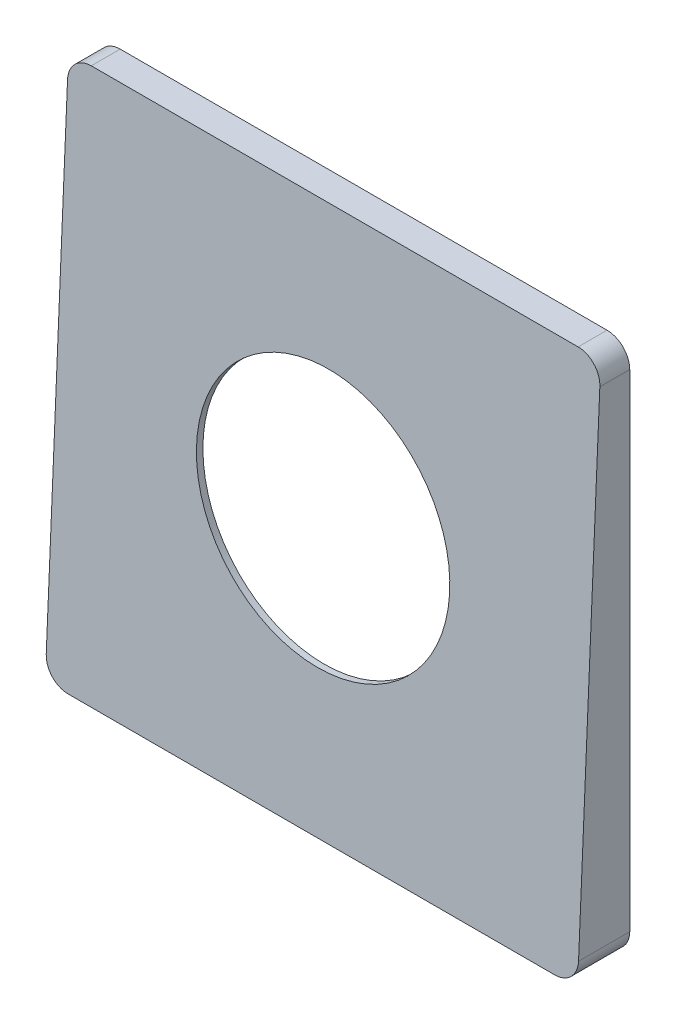
from build123d import *

# Parameters (mm, degrees)
EXTRUDE_THIN1_DEPTH     = 8
CUT_EXTRUDE2_DEPTH      = 120
BOSS_EXTRUDE1_DEPTH     = 82
CUT_EXTRUDE_THIN1_DEPTH = 82
SKETCH8_R               = 19.5
CUT_EXTRUDE3_DEPTH      = 82


with BuildPart() as part:
    # Sketch1 → Extrude-Thin1 (new body)
    with BuildSketch(Plane.XY):
        with BuildLine():
            Line((-37.5, 41), (37.5, 41))
            ThreePointArc((37.5, 41), (39.974873734, 39.974873734), (41, 37.5))
            Line((41, 37.5), (41, -37.5))
            ThreePointArc((41, -37.5), (39.974873734, -39.974873734), (37.5, -41))
            Line((37.5, -41), (-37.5, -41))
            ThreePointArc((-37.5, -41), (-39.974873734, -39.974873734), (-41, -37.5))
            Line((-41, -37.5), (-41, 37.5))
            ThreePointArc((-41, 37.5), (-39.974873734, 39.974873734), (-37.5, 41))
        make_face()
        with BuildLine():
            Line((-37.5, 40), (37.5, 40))
            ThreePointArc((37.5, 40), (39.267766953, 39.267766953), (40, 37.5))
            Line((40, 37.5), (40, -37.5))
            ThreePointArc((40, -37.5), (39.267766953, -39.267766953), (37.5, -40))
            Line((37.5, -40), (-37.5, -40))
            ThreePointArc((-37.5, -40), (-39.267766953, -39.267766953), (-40, -37.5))
            Line((-40, -37.5), (-40, 37.5))
            ThreePointArc((-40, 37.5), (-39.267766953, 39.267766953), (-37.5, 40))
        make_face(mode=Mode.SUBTRACT)
    extrude(amount=EXTRUDE_THIN1_DEPTH)

    # Sketch5 → Cut-Extrude2 (cut)
    with BuildSketch(Plane(origin=(41, 0, 0), x_dir=(0, 0, -1), z_dir=(1, 0, 0))):
        Polygon((-3.45625, 41), (-8, 41), (-8, -41), (-7.04375, -41), align=None)
    extrude(amount=-CUT_EXTRUDE2_DEPTH, mode=Mode.SUBTRACT)

    # Sketch6 → Boss-Extrude1 (add)
    with BuildSketch(Plane(origin=(41, 0, 0), x_dir=(0, 0, -1), z_dir=(1, 0, 0))):
        Polygon((-7.04375, -41), (-3.45625, 41), (-4.457206574, 41), (-8.044706574, -41), align=None)
    extrude(amount=-BOSS_EXTRUDE1_DEPTH)

    # Sketch7 → Cut-Extrude-Thin1 (cut)
    with BuildSketch(Plane(origin=(0, 0, 0), x_dir=(-1, 0, 0), z_dir=(0, 0, -1))):
        with BuildLine():
            Line((-37.5, 52), (37.5, 52))
            ThreePointArc((37.5, 52), (47.753048327, 47.753048327), (52, 37.5))
            Line((52, 37.5), (52, -37.5))
            ThreePointArc((52, -37.5), (47.753048327, -47.753048327), (37.5, -52))
            Line((37.5, -52), (-37.5, -52))
            ThreePointArc((-37.5, -52), (-47.753048327, -47.753048327), (-52, -37.5))
            Line((-52, -37.5), (-52, 37.5))
            ThreePointArc((-52, 37.5), (-47.753048327, 47.753048327), (-37.5, 52))
        make_face()
        with BuildLine():
            Line((-37.5, 41), (37.5, 41))
            ThreePointArc((37.5, 41), (39.974873734, 39.974873734), (41, 37.5))
            Line((41, 37.5), (41, -37.5))
            ThreePointArc((41, -37.5), (39.974873734, -39.974873734), (37.5, -41))
            Line((37.5, -41), (-37.5, -41))
            ThreePointArc((-37.5, -41), (-39.974873734, -39.974873734), (-41, -37.5))
            Line((-41, -37.5), (-41, 37.5))
            ThreePointArc((-41, 37.5), (-39.974873734, 39.974873734), (-37.5, 41))
        make_face(mode=Mode.SUBTRACT)
    extrude(amount=-CUT_EXTRUDE_THIN1_DEPTH, mode=Mode.SUBTRACT)

    # Sketch8 → Cut-Extrude3 (cut)
    with BuildSketch(Plane(origin=(0, 0.272956894, 6.23901471), x_dir=(1, 0, 0), z_dir=(0, 0.043708189893615426, 0.9990443404255007))):
        Circle(SKETCH8_R)
    extrude(amount=-CUT_EXTRUDE3_DEPTH, mode=Mode.SUBTRACT)


solid = part.part
